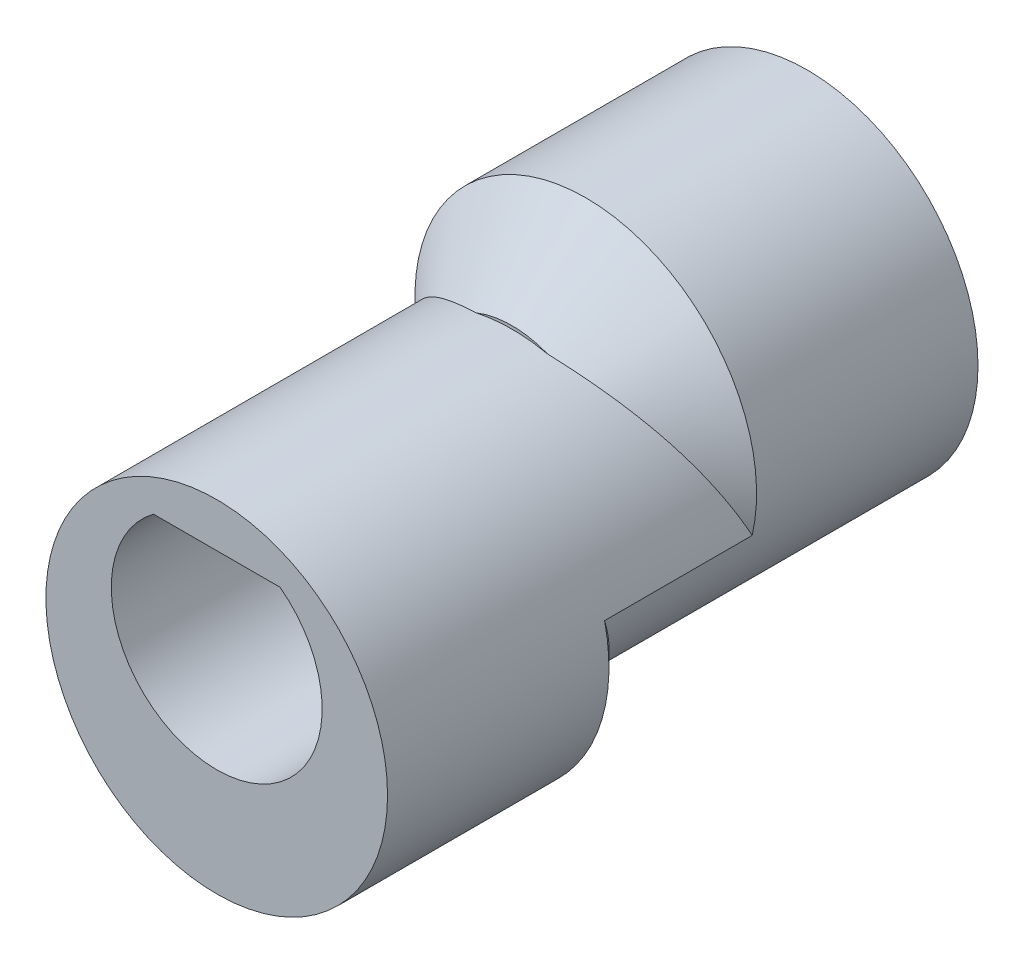
from build123d import *

# Parameters (mm, degrees)
ESQUISSE1_R             = 4.05
BOSS_EXTRU_1_DEPTH      = 7
ESQUISSE2_R             = 4.05
BOSS_EXTRU_2_DEPTH      = 7
ENL_V_MAT_EXTRU_1_DEPTH = 16.424169346
CHANFREIN2_SIZE         = 1.75
CHANFREIN4_SIZE         = 1.75


with BuildPart() as part:
    # Esquisse1 → Boss.-Extru.1 (new body)
    with BuildSketch(Plane.XY):
        with Locations((0, 0.822072072)):
            Circle(ESQUISSE1_R)
    extrude(amount=BOSS_EXTRU_1_DEPTH)

    # Esquisse2 → Boss.-Extru.2 (add)
    with BuildSketch(Plane.XY.offset(7)):
        with Locations(Location((0, -1, 0), (0, 0, 167.000228446))):
            Circle(ESQUISSE2_R)
    extrude(amount=BOSS_EXTRU_2_DEPTH)

    # Esquisse3 → Enlèv. mat.-Extru.1 (cut, through all)
    with BuildSketch(Plane.XY.offset(14)):
        with BuildLine():
            Line((-1.5, 2), (1.5, 2))
            ThreePointArc((1.5, 2), (0, -2.5), (-1.5, 2))
        make_face()
    extrude(amount=-ENL_V_MAT_EXTRU_1_DEPTH, mode=Mode.SUBTRACT)

    # Chanfrein2
    # the kernel refuses this chamfer: 1.75 mm, written as the material it takes off along each edge
    with BuildSketch(Plane(origin=(0, 0.822072072, 7), x_dir=(1, 0, 0), z_dir=(0, -1, 0))) as chanfrein2_piece_1_section:
        Polygon((4.05, -CHANFREIN2_SIZE), (4.05 - CHANFREIN2_SIZE, 0), (4.05, 0), align=None)
    chanfrein2_piece_1 = revolve(axis=Axis((0, 0.822072072, 7), (0, 0, 1)), revolution_arc=256.785781501, mode=Mode.PRIVATE)
    chanfrein2_piece_1 = chanfrein2_piece_1 - Plane(origin=(0, -1, 6.142651894), x_dir=(-0.9743709616876816, 0.22494716939722223, 0), z_dir=(0, 0, -1)) * Cylinder(4.05, 17, mode=Mode.PRIVATE)
    add(chanfrein2_piece_1, mode=Mode.SUBTRACT)
    with BuildSketch(Plane(origin=(0, 0.822072072, 7), x_dir=(0.23058336065371998, -0.9730525750387985, 0), z_dir=(-0.9730525750387985, -0.23058336065371998, 0))) as chanfrein2_piece_2_section:
        Polygon((4.05, -CHANFREIN2_SIZE), (4.05 - CHANFREIN2_SIZE, 0), (4.05, 0), align=None)
    chanfrein2_piece_2 = revolve(axis=Axis((0, 0.822072072, 7), (0, 0, 1)), revolution_arc=76.66858095, mode=Mode.PRIVATE)
    chanfrein2_piece_2 = chanfrein2_piece_2 - Plane(origin=(0, -1, 6.19314211), x_dir=(-0.9743709616876816, 0.22494716939722223, 0), z_dir=(0, 0, -1)) * Cylinder(4.05, 17, mode=Mode.PRIVATE)
    add(chanfrein2_piece_2, mode=Mode.SUBTRACT)

    # Chanfrein4
    # the kernel refuses this chamfer: 1.75 mm, written as the material it takes off along each edge
    with BuildSketch(Plane(origin=(0, -1, 7), x_dir=(-0.22831348546058428, 0.9735876706064225, 0), z_dir=(0.9735876706064225, 0.22831348546058428, 0))) as chanfrein4_piece_1_section:
        Polygon((4.05 - CHANFREIN4_SIZE, 0), (4.05, CHANFREIN4_SIZE), (4.05, 0), align=None)
    chanfrein4_piece_1 = revolve(axis=Axis((0, -1, 7), (0, 0, 1)), revolution_arc=333.604400204, mode=Mode.PRIVATE)
    chanfrein4_piece_1 = chanfrein4_piece_1 - Plane(origin=(0, 0.822072072, 7.857230716), x_dir=(1, 0, 0), z_dir=(0, 0, -1)) * Cylinder(4.05, 17, mode=Mode.PRIVATE)
    add(chanfrein4_piece_1, mode=Mode.SUBTRACT)


solid = part.part
